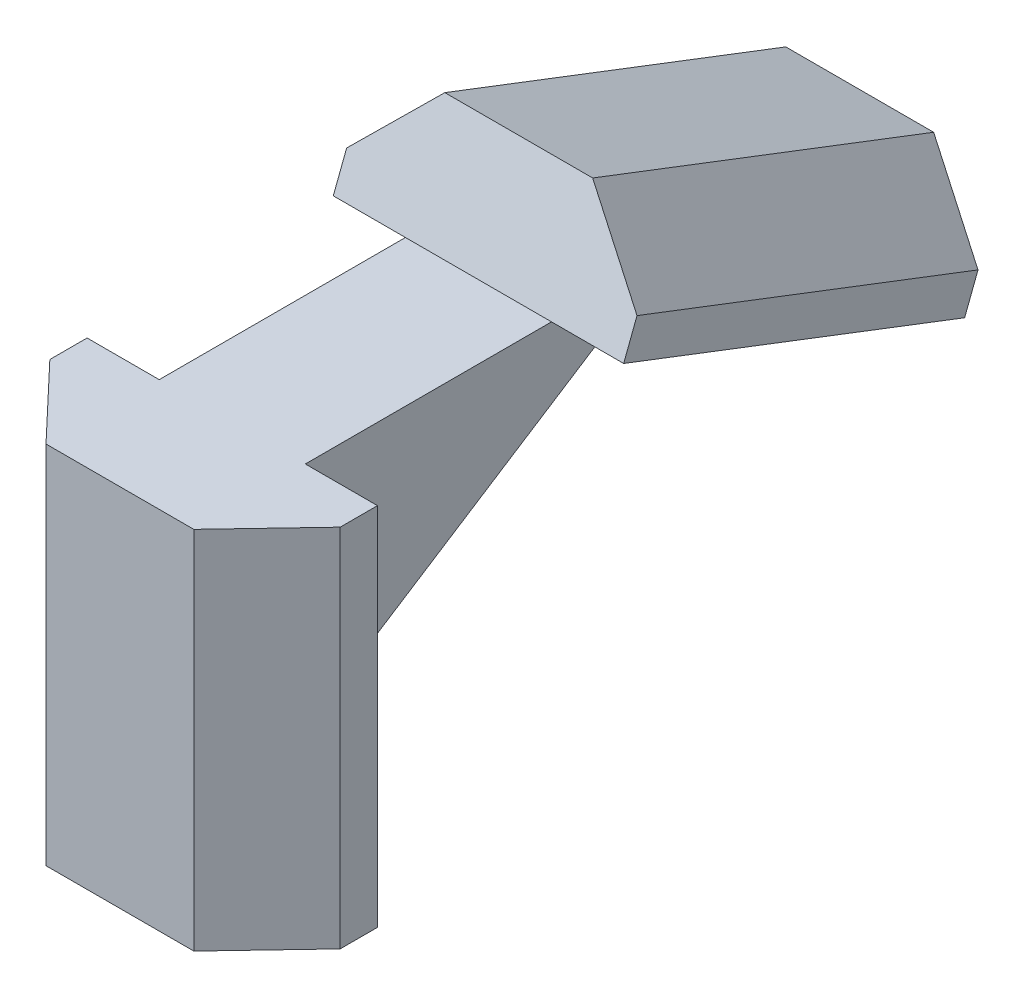
from build123d import *

# Parameters (mm, degrees)
BOSS_EXTRUDE1_DEPTH = 20
BOSS_EXTRUDE3_DEPTH = 4
SKETCH11_W          = 8
SKETCH11_H          = 4.067153682
BOSS_EXTRUDE8_DEPTH = 1
BOSS_EXTRUDE7_DEPTH = 20


with BuildPart() as part:
    # Sketch1 → Boss-Extrude1 (new body)
    with BuildSketch(Plane(origin=(0, 0, 0), x_dir=(1, 0, 0), z_dir=(0, 1, 0))):
        Polygon((-7.95, -2.04), (-7.95, 0), (7.95, 0), (7.95, -2.04), (4.048, -6.152414984), (-4.048, -6.152414984), align=None)
    extrude(amount=-BOSS_EXTRUDE1_DEPTH)

    # Sketch4 → Boss-Extrude3 (add, symmetric)
    with BuildSketch(Plane(origin=(0, 0, 0), x_dir=(0, 0, -1), z_dir=(1, 0, 0))):
        Polygon((0, 0), (13.481068451, 0), (17.27808352, -1.457537526), (0, -12.539693486), align=None)
    extrude(amount=BOSS_EXTRUDE3_DEPTH, both=True)

    # Sketch11 → Boss-Extrude8 (add)
    with BuildSketch(Plane(origin=(0, 4.510297753, -1.731341095), x_dir=(1, 0, 0), z_dir=(0, 0.9335804264972002, -0.35836794954530443))):
        with Locations((0, 14.619238475)):
            Rectangle(SKETCH11_W, SKETCH11_H)
    extrude(amount=BOSS_EXTRUDE8_DEPTH)

    # Sketch10 → Boss-Extrude7 (add)
    with BuildSketch(Plane(origin=(0, -4.510297753, -11.749727356), x_dir=(1, 0, 0), z_dir=(0, 0.3583679495453044, 0.9335804264972001))):
        Polygon((-7.95, 4.831182858), (-7.95, 6.871182858), (-4.048, 10.983597842), (4.048, 10.983597842), (7.95, 6.871182858), (7.95, 4.831182858), align=None)
    extrude(amount=-BOSS_EXTRUDE7_DEPTH)


solid = part.part
